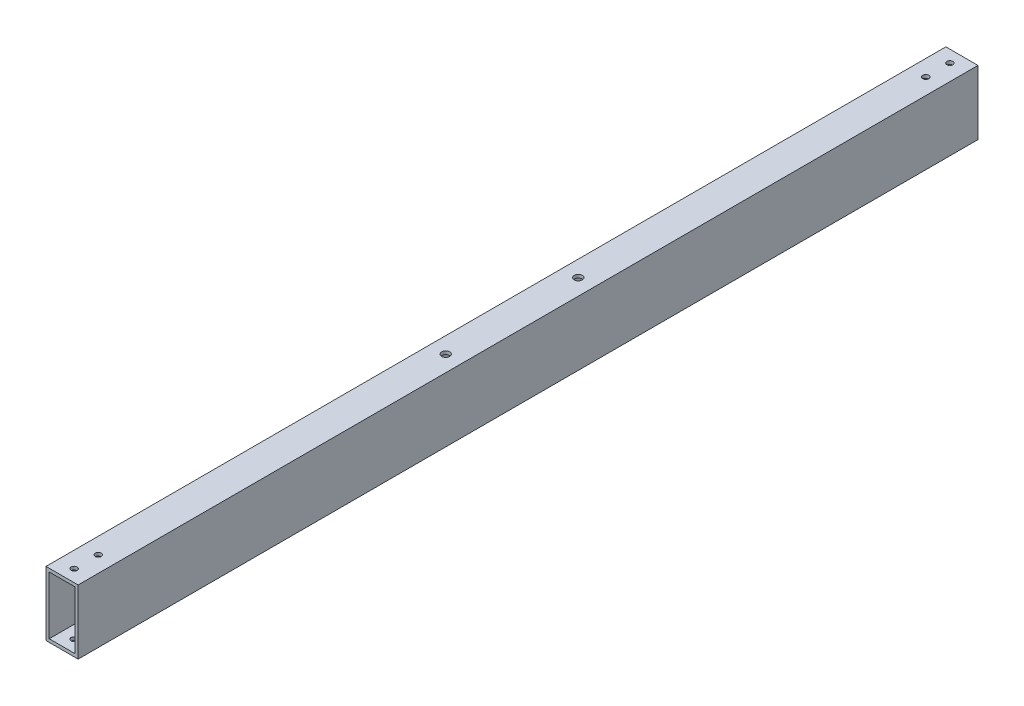
from build123d import *

# Parameters (mm, degrees)
SKETCH1_W           = 25.4
SKETCH1_H           = 50.8
BOSS_EXTRUDE1_DEPTH = 355.6
SHELL1_T            = -2.54
SKETCH2_R           = 2.38125
CUT_EXTRUDE1_DEPTH  = 360.434681131
SKETCH3_R           = 3.175
CUT_EXTRUDE2_DEPTH  = 360.434681131


with BuildPart() as part:
    # Sketch1 → Boss-Extrude1 (new, symmetric)
    with BuildSketch(Plane.XY):
        Rectangle(SKETCH1_W, SKETCH1_H)
    extrude(amount=BOSS_EXTRUDE1_DEPTH, both=True)

    # Shell1
    shell1_openings = [part.faces().sort_by_distance(p)[0] for p in [
        (0, 0, -355.6),
        (0, 0, 355.6),
    ]]
    offset(amount=SHELL1_T, openings=shell1_openings, kind=Kind.INTERSECTION)

    # Sketch2 → Cut-Extrude1 (cut, through all)
    with BuildSketch(Plane.XZ.offset(25.4)):
        with Locations((0, 346.075)):
            Circle(SKETCH2_R)
        with Locations((0, 327.025)):
            Circle(SKETCH2_R)
        with Locations((0, -327.025)):
            Circle(SKETCH2_R)
        with Locations((0, -346.075)):
            Circle(SKETCH2_R)
    extrude(amount=-CUT_EXTRUDE1_DEPTH, mode=Mode.SUBTRACT)

    # Sketch3 → Cut-Extrude2 (cut, through all)
    with BuildSketch(Plane.XZ.offset(25.4)):
        with Locations((0, 52.3875)):
            Circle(SKETCH3_R)
        with Locations((0, -52.3875)):
            Circle(SKETCH3_R)
    extrude(amount=-CUT_EXTRUDE2_DEPTH, mode=Mode.SUBTRACT)


solid = part.part
